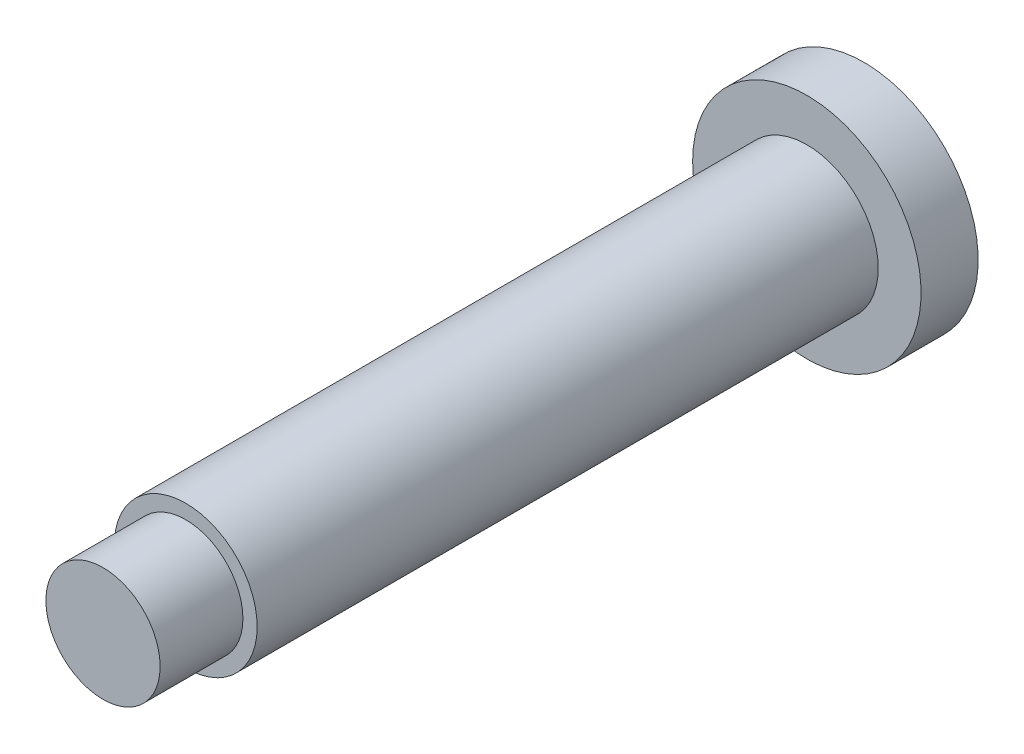
from build123d import *

# Parameters (mm, degrees)
SKETCH1_R           = 2.5
BOSS_EXTRUDE1_DEPTH = 21.75
SKETCH2_R           = 4
BOSS_EXTRUDE2_DEPTH = 2
SKETCH3_R           = 2.05
CUT_EXTRUDE1_DEPTH  = 3
SKETCH4_R           = 2
BOSS_EXTRUDE3_DEPTH = 2.9


with BuildPart() as part:
    # Sketch1 → Boss-Extrude1 (new body)
    with BuildSketch(Plane(origin=(0, 0, 0), x_dir=(0, 1, 0), z_dir=(0, 0, 1))):
        Circle(SKETCH1_R)
    extrude(amount=BOSS_EXTRUDE1_DEPTH)

    # Sketch2 → Boss-Extrude2 (add)
    with BuildSketch(Plane(origin=(0, 0, 0), x_dir=(1, 0, 0), z_dir=(0, 0, -1))):
        Circle(SKETCH2_R)
    extrude(amount=BOSS_EXTRUDE2_DEPTH)

    # Sketch3 → Cut-Extrude1 (cut)
    with BuildSketch(Plane(origin=(0, 0, -2), x_dir=(1, 0, 0), z_dir=(0, 0, -1))):
        Circle(SKETCH3_R)
    extrude(amount=-CUT_EXTRUDE1_DEPTH, mode=Mode.SUBTRACT)

    # Sketch4 → Boss-Extrude3 (add)
    with BuildSketch(Plane.XY.offset(21.75)):
        Circle(SKETCH4_R)
    extrude(amount=BOSS_EXTRUDE3_DEPTH)


solid = part.part
